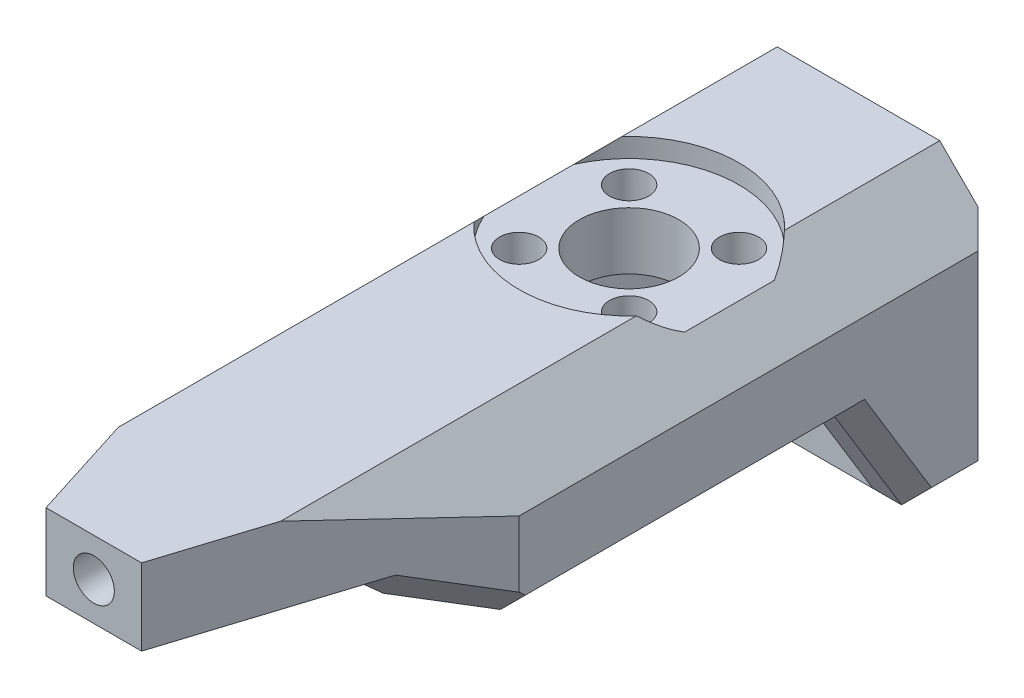
from build123d import *

# Parameters (mm, degrees)
SKETCH1_W           = 26
SKETCH1_H           = 23
SKETCH1_R           = 1.05
BOSS_EXTRUDE1_DEPTH = 8
SKETCH2_R           = 3.55
CUT_EXTRUDE1_DEPTH  = 1
BOSS_EXTRUDE2_DEPTH = 72
SKETCH4_W           = 80
SKETCH4_H           = 23
BOSS_EXTRUDE3_DEPTH = 1.5
SKETCH5_W           = 80
SKETCH5_H           = 23
BOSS_EXTRUDE4_DEPTH = 1.5
SKETCH6_W           = 29
SKETCH6_H           = 80
BOSS_EXTRUDE5_DEPTH = 2
CUT_EXTRUDE2_DEPTH  = 87.15828457
SKETCH8_W           = 30
SKETCH8_H           = 4
BOSS_EXTRUDE6_DEPTH = 29
CUT_EXTRUDE3_DEPTH  = 87.32062326
SKETCH10_W          = 15.789473684
SKETCH10_H          = 7.5
CUT_EXTRUDE4_DEPTH  = 87.874910072
CHAMFER1_SIZE2      = 7.5
CHAMFER1_SIZE       = 15
CHAMFER2_SIZE2      = 7.5
CHAMFER2_SIZE       = 15
CHAMFER3_SIZE       = 4
CHAMFER3_SIZE_2     = 10
SKETCH12_R          = 5.2
CUT_EXTRUDE5_DEPTH  = 86.060272748
SKETCH14_R          = 2.05
CUT_EXTRUDE6_DEPTH  = 5
SKETCH15_R          = 2.15
CUT_EXTRUDE8_DEPTH  = 22
SKETCH21_W          = 29
SKETCH21_H          = 2
CUT_EXTRUDE9_DEPTH  = 84.165497654
BOSS_EXTRUDE7_REACH = 84.768
SKETCH22_W          = 29
SKETCH22_H          = 2
SKETCH23_R          = 5.2
CUT_EXTRUDE10_DEPTH = 86.060272748
SKETCH24_R          = 11.5
CUT_EXTRUDE11_DEPTH = 2
CHAMFER6_SIZE       = 2


# Some blends are built 0.0001 mm under size
with BuildPart() as part:
    # Sketch1 → Boss-Extrude1 (new body)
    with BuildSketch(Plane.XY):
        Rectangle(SKETCH1_W, SKETCH1_H)
        with Locations((-6, 4)):
            Circle(SKETCH1_R, mode=Mode.SUBTRACT)
        with Locations((6, 4)):
            Circle(SKETCH1_R, mode=Mode.SUBTRACT)
        with Locations((-6, -4)):
            Circle(SKETCH1_R, mode=Mode.SUBTRACT)
        with Locations((6, -4)):
            Circle(SKETCH1_R, mode=Mode.SUBTRACT)
    extrude(amount=BOSS_EXTRUDE1_DEPTH)

    # Sketch2 → Cut-Extrude1 (cut)
    with BuildSketch(Plane.XY.offset(8)):
        with Locations((-6, 4)):
            Circle(SKETCH2_R)
        with Locations((6, 4)):
            Circle(SKETCH2_R)
        with Locations((6, -4)):
            Circle(SKETCH2_R)
        with Locations((-6, -4)):
            Circle(SKETCH2_R)
    extrude(amount=-CUT_EXTRUDE1_DEPTH, mode=Mode.SUBTRACT)

    # Sketch3 → Boss-Extrude2 (add)
    with BuildSketch(Plane.XY.offset(8)):
        Polygon((-13, 11.5), (13, 11.5), (13, 7.5), (13, -11.5), (9.5, -11.5), (9.5, 7.5), (-9.5, 7.5), (-9.5, -11.5), (-13, -11.5), (-13, 7.5), align=None)
    extrude(amount=BOSS_EXTRUDE2_DEPTH)

    # Sketch4 → Boss-Extrude3 (add)
    with BuildSketch(Plane.ZY.offset(13)):
        with Locations((40, 0)):
            Rectangle(SKETCH4_W, SKETCH4_H)
    extrude(amount=BOSS_EXTRUDE3_DEPTH)

    # Sketch5 → Boss-Extrude4 (add)
    with BuildSketch(Plane(origin=(13, 0, 0), x_dir=(0, 0, -1), z_dir=(1, 0, 0))):
        with Locations((-40, 0)):
            Rectangle(SKETCH5_W, SKETCH5_H)
    extrude(amount=BOSS_EXTRUDE4_DEPTH)

    # Sketch6 → Boss-Extrude5 (add)
    with BuildSketch(Plane(origin=(0, 11.5, 0), x_dir=(1, 0, 0), z_dir=(0, 1, 0))):
        with Locations((0, -40)):
            Rectangle(SKETCH6_W, SKETCH6_H)
    extrude(amount=BOSS_EXTRUDE5_DEPTH)

    # Sketch7 → Cut-Extrude2 (cut, through all)
    with BuildSketch(Plane(origin=(14.5, 0, 0), x_dir=(0, 0, -1), z_dir=(1, 0, 0))):
        Polygon((-8, -11.5), (-15, 0), (-52, 0), (-80, 7.5), (-80, -11.5), align=None)
    extrude(amount=-CUT_EXTRUDE2_DEPTH, mode=Mode.SUBTRACT)

    # Sketch8 → Boss-Extrude6 (add)
    with BuildSketch(Plane.ZY.offset(14.5)):
        with Locations((65, 15.5)):
            Rectangle(SKETCH8_W, SKETCH8_H)
    extrude(amount=-BOSS_EXTRUDE6_DEPTH)

    # Sketch9 → Cut-Extrude3 (cut, through all)
    with BuildSketch(Plane(origin=(0, 17.5, 0), x_dir=(1, 0, 0), z_dir=(0, 1, 0))):
        Polygon((-5, -80), (-14.5, -50), (-14.5, -80), align=None)
        Polygon((14.5, -50), (14.5, -80), (5, -80), align=None)
    extrude(amount=-CUT_EXTRUDE3_DEPTH, mode=Mode.SUBTRACT)

    # Sketch10 → Cut-Extrude4 (cut, through all)
    with BuildSketch(Plane(origin=(14.5, 0, 0), x_dir=(0, 0, -1), z_dir=(1, 0, 0))):
        with Locations((-57.894736842, 3.75)):
            Rectangle(SKETCH10_W, SKETCH10_H)
    extrude(amount=-CUT_EXTRUDE4_DEPTH, mode=Mode.SUBTRACT)

    # Chamfer1
    chamfer1_edges = [part.edges().sort_by_distance(p)[0] for p in [
        (12, 7.5, 50),
    ]]
    chamfer1_side = [part.faces().sort_by_distance(p)[0] for p in [
        (12, 7.5, 50.15),
    ]]
    chamfer(chamfer1_edges, length=CHAMFER1_SIZE - 0.0001, length2=CHAMFER1_SIZE2 - 0.0001, reference=chamfer1_side[0])  # a hair under: the kernel refuses the full size

    # Chamfer2
    chamfer2_edges = [part.edges().sort_by_distance(p)[0] for p in [
        (-12, 7.5, 50),
    ]]
    chamfer2_side = [part.faces().sort_by_distance(p)[0] for p in [
        (-12, 7.5, 50.15),
    ]]
    chamfer(chamfer2_edges, length=CHAMFER2_SIZE - 0.0001, length2=CHAMFER2_SIZE2 - 0.0001, reference=chamfer2_side[0])  # a hair under: the kernel refuses the full size

    # Chamfer3
    # the kernel refuses this chamfer: 10, 4 mm, written as the material it adds along each edge
    with BuildSketch(Plane(origin=(-14.5, 13.5, 50), x_dir=(0, 0.996016754004022, 0.08916628142572501), z_dir=(1, 0, 0))) as chamfer3_piece_1_section:
        Polygon((CHAMFER3_SIZE * 0.996016754004, -CHAMFER3_SIZE * 0.0891662814257), (-CHAMFER3_SIZE_2 * 0.0891662814257, -CHAMFER3_SIZE_2 * 0.996016754004), (0, 0), align=None)
    chamfer3_piece_1 = extrude(amount=29, mode=Mode.PRIVATE)
    chamfer3_piece_1 = split(chamfer3_piece_1, bisect_by=Plane(origin=(0, 17.5, 46.584895752), z_dir=(0, -1, 0)), keep=Keep.TOP, mode=Mode.PRIVATE)
    chamfer3_piece_1 = split(chamfer3_piece_1, bisect_by=Plane(origin=(-14.161378148, 14.736098837, 51.069332166), z_dir=(0.9533422253507436, 0, -0.3018917046944019)), keep=Keep.TOP, mode=Mode.PRIVATE)
    chamfer3_piece_1 = split(chamfer3_piece_1, bisect_by=Plane(origin=(14.161378148, 14.736098837, 51.069332166), z_dir=(-0.9533422253507436, 0, -0.30189170469440213)), keep=Keep.TOP, mode=Mode.PRIVATE)
    add(chamfer3_piece_1)

    # Sketch12 → Cut-Extrude5 (cut, through all)
    with BuildSketch(Plane(origin=(0, 13.5, 0), x_dir=(1, 0, 0), z_dir=(0, 1, 0))):
        with Locations(Location((0, -24, 0), (0, 0, 270))):
            Circle(SKETCH12_R)
    extrude(amount=-CUT_EXTRUDE5_DEPTH, mode=Mode.SUBTRACT)

    # Sketch14 → Cut-Extrude6 (cut)
    with BuildSketch(Plane(origin=(0, 13.5, 0), x_dir=(1, 0, 0), z_dir=(0, 1, 0))):
        with Locations(Location((5.75, -18.25, 0), (0, 0, 270))):
            Circle(SKETCH14_R)
        with Locations(Location((5.75, -29.75, 0), (0, 0, 270))):
            Circle(SKETCH14_R)
        with Locations(Location((-5.75, -29.75, 0), (0, 0, 270))):
            Circle(SKETCH14_R)
        with Locations(Location((-5.75, -18.25, 0), (0, 0, 270))):
            Circle(SKETCH14_R)
    extrude(amount=-CUT_EXTRUDE6_DEPTH, mode=Mode.SUBTRACT)

    # Sketch15 → Cut-Extrude8 (cut)
    with BuildSketch(Plane.XY.offset(80)):
        with Locations((0, 11.5)):
            Circle(SKETCH15_R)
    extrude(amount=-CUT_EXTRUDE8_DEPTH, mode=Mode.SUBTRACT)

    # Sketch21 → Cut-Extrude9 (cut, through all)
    with BuildSketch(Plane.XY.offset(80)):
        with Locations((0, 16.5)):
            Rectangle(SKETCH21_W, SKETCH21_H)
    extrude(amount=-CUT_EXTRUDE9_DEPTH, mode=Mode.SUBTRACT)

    # Boss-Extrude7: up to this face of the body (flat: up to its plane)
    boss_extrude7_end = Plane(part.part.faces().sort_by_distance((0, 14.5, 42.5))[0])
    # Sketch22 → Boss-Extrude7 (add, up to the picked face)
    with BuildSketch(Plane(origin=(0, 0, 0), x_dir=(-1, 0, 0), z_dir=(0, 0, -1)), mode=Mode.PRIVATE) as boss_extrude7_sk1:
        with Locations((0, 14.5)):
            Rectangle(SKETCH22_W, SKETCH22_H)
    boss_extrude7_tool1 = split(extrude(boss_extrude7_sk1.sketch, amount=-BOSS_EXTRUDE7_REACH, mode=Mode.PRIVATE), bisect_by=boss_extrude7_end, keep=Keep.BOTH, mode=Mode.PRIVATE)
    add(boss_extrude7_tool1.solids().sort_by(Axis((0, 14.5, 0), (0, 0, 1)))[0])

    # Sketch23 → Cut-Extrude10 (cut, through all)
    with BuildSketch(Plane(origin=(0, 13.5, 0), x_dir=(-1, 0, 0), z_dir=(0, -1, 0))):
        with Locations(Location((0, -24, 0), (0, 0, 270))):
            Circle(SKETCH23_R)
    extrude(amount=-CUT_EXTRUDE10_DEPTH, mode=Mode.SUBTRACT)

    # Sketch24 → Cut-Extrude11 (cut)
    with BuildSketch(Plane(origin=(0, 15.5, 0), x_dir=(1, 0, 0), z_dir=(0, 1, 0))):
        with Locations(Location((0, -24, 0), (0, 0, 270))):
            Circle(SKETCH24_R)
    extrude(amount=-CUT_EXTRUDE11_DEPTH, mode=Mode.SUBTRACT)

    # Chamfer4
    # the kernel refuses this chamfer: 6 mm, written as the material it takes off along each edge
    with BuildSketch(Plane(origin=(-14.5, 15.5, 87.032235027), x_dir=(-0.0274958766105865, -0.9996219169112968, 0), z_dir=(0, 0, -1)), Plane(origin=(14.5, 15.5, 87.032235027), x_dir=(-0.9996219169112969, 0.02749587661058649, 0), z_dir=(0, 0, -1))) as chamfer4_piece_1:
        with BuildLine():
            Line((6.172039171, 0), (-0.339282929, -6.162706761))
            Line((-0.339282929, -6.162706761), (-0.459237559, -6.159407256))
            ThreePointArc((-0.459237559, -6.159407256), (-0.204775362, -3.080386978), (-0.11995463, 0.003299505))
            Line((-0.11995463, 0.003299505), (0.003299505, 0.11995463))
            ThreePointArc((0.003299505, 0.11995463), (3.086985988, 0.035133898), (6.175338676, 0.11995463))
            Line((6.175338676, 0.11995463), (6.172039171, 0))
        make_face()
    extrude(amount=124.064470053, mode=Mode.SUBTRACT)

    # Chamfer5
    # the kernel refuses this chamfer: 2.336899136, 2 mm, written as the material it takes off along each edge
    with BuildSketch(Plane(origin=(-8.106777279, 10.094594893, 70.189124382), x_dir=(0.961659390492848, -0.1504091467073527, -0.22932140166955664), z_dir=(-0.2725155737769916, -0.43028487946482336, -0.8605754961378691))) as chamfer5_piece_1_section:
        with BuildLine():
            Line((2.067154496, 0), (-0.457557549, -2.368181214))
            Line((-0.457557549, -2.368181214), (-0.503642169, -2.360393606))
            ThreePointArc((-0.503642169, -2.360393606), (-0.246974517, -1.1810158), (-0.04608462, 0.007787608))
            Line((-0.04608462, 0.007787608), (0.001494452, 0.046714084))
            ThreePointArc((0.001494452, 0.046714084), (1.034014963, 0.013682238), (2.068648949, 0.046714084))
            Line((2.068648949, 0.046714084), (2.067154496, 0))
        make_face()
    chamfer5_piece_1 = extrude(amount=29.489973718, mode=Mode.PRIVATE)
    chamfer5_piece_1 = split(chamfer5_piece_1, bisect_by=Plane(origin=(-11.667443521, 7.5, 56.707905071), z_dir=(0, -1, 0)), keep=Keep.TOP, mode=Mode.PRIVATE)
    add(chamfer5_piece_1, mode=Mode.SUBTRACT)
    with BuildSketch(Plane(origin=(8.106777279, 10.094594893, 70.189124382), x_dir=(-0.961659390492848, -0.1504091467073528, -0.22932140166955695), z_dir=(0.27251557377699187, -0.4302848794648234, -0.860575496137869))) as chamfer5_piece_2_section:
        with BuildLine():
            Line((2.067154496, 0), (-0.457557549, 2.368181214))
            Line((-0.457557549, 2.368181214), (-0.503642169, 2.360393606))
            ThreePointArc((-0.503642169, 2.360393606), (-0.246974517, 1.1810158), (-0.04608462, -0.007787608))
            Line((-0.04608462, -0.007787608), (0.001494452, -0.046714084))
            ThreePointArc((0.001494452, -0.046714084), (1.034014963, -0.013682238), (2.068648949, -0.046714084))
            Line((2.068648949, -0.046714084), (2.067154496, 0))
        make_face()
    chamfer5_piece_2 = extrude(amount=29.489973718, mode=Mode.PRIVATE)
    chamfer5_piece_2 = split(chamfer5_piece_2, bisect_by=Plane(origin=(11.667443521, 7.5, 56.707905071), z_dir=(0, -1, 0)), keep=Keep.TOP, mode=Mode.PRIVATE)
    add(chamfer5_piece_2, mode=Mode.SUBTRACT)
    with BuildSketch(Plane(origin=(14.5, 0, 9.856634024), x_dir=(0.02749587661058647, 0.9996219169112968, 0), z_dir=(0, 0, 1))) as chamfer5_piece_3_section:
        with BuildLine():
            Line((2.05734639, 0), (-0.11309431, 2.054235587))
            Line((-0.11309431, 2.054235587), (-0.153079186, 2.053135752))
            ThreePointArc((-0.153079186, 2.053135752), (-0.068258454, 1.026795659), (-0.039984877, -0.001099835))
            Line((-0.039984877, -0.001099835), (0.001099835, -0.039984877))
            ThreePointArc((0.001099835, -0.039984877), (1.028995329, -0.011711299), (2.058446225, -0.039984877))
            Line((2.058446225, -0.039984877), (2.05734639, 0))
        make_face()
    chamfer5_piece_3 = extrude(amount=45.286731952, mode=Mode.PRIVATE)
    chamfer5_piece_3 = split(chamfer5_piece_3, bisect_by=Plane(origin=(13.83833288, 9.481660415, 20.77144547), z_dir=(0, -0.5199469468957453, 0.8541985556144386)), keep=Keep.TOP, mode=Mode.PRIVATE)
    add(chamfer5_piece_3, mode=Mode.SUBTRACT)
    with BuildSketch(Plane(origin=(-14.5, 4.393455788, 17.674277436), x_dir=(-0.027495876610586452, 0.519750363748101, -0.8538755975861659), z_dir=(0, -0.8541985556144386, -0.5199469468957453))) as chamfer5_piece_4_section:
        with BuildLine():
            Line((2.05734639, 0), (-0.11309431, 2.054235587))
            Line((-0.11309431, 2.054235587), (-0.153079186, 2.053135752))
            ThreePointArc((-0.153079186, 2.053135752), (-0.068258454, 1.026795659), (-0.039984877, -0.001099835))
            Line((-0.039984877, -0.001099835), (0.001099835, -0.039984877))
            ThreePointArc((0.001099835, -0.039984877), (1.028995329, -0.011711299), (2.058446225, -0.039984877))
            Line((2.058446225, -0.039984877), (2.05734639, 0))
        make_face()
    chamfer5_piece_4 = extrude(amount=23.74964397, mode=Mode.PRIVATE)
    chamfer5_piece_4 = split(chamfer5_piece_4, bisect_by=Plane(origin=(-13.835872305, 0, 9.503665371), z_dir=(0, -1, 0)), keep=Keep.TOP, mode=Mode.PRIVATE)
    add(chamfer5_piece_4, mode=Mode.SUBTRACT)
    with BuildSketch(Plane(origin=(14.5, -15.893455788, 5.325722564), x_dir=(0.027495876610586504, 0.5197503637481011, -0.8538755975861659), z_dir=(0, 0.8541985556144386, 0.5199469468957453))) as chamfer5_piece_5_section:
        with BuildLine():
            Line((2.05734639, 0), (-0.11309431, 2.054235587))
            Line((-0.11309431, 2.054235587), (-0.153079186, 2.053135752))
            ThreePointArc((-0.153079186, 2.053135752), (-0.068258454, 1.026795659), (-0.039984877, -0.001099835))
            Line((-0.039984877, -0.001099835), (0.001099835, -0.039984877))
            ThreePointArc((0.001099835, -0.039984877), (1.028995329, -0.011711299), (2.058446225, -0.039984877))
            Line((2.058446225, -0.039984877), (2.05734639, 0))
        make_face()
    chamfer5_piece_5 = extrude(amount=23.74964397, mode=Mode.PRIVATE)
    chamfer5_piece_5 = split(chamfer5_piece_5, bisect_by=Plane(origin=(13.835872305, 0, 9.503665371), z_dir=(0, -1, 0)), keep=Keep.TOP, mode=Mode.PRIVATE)
    add(chamfer5_piece_5, mode=Mode.SUBTRACT)
    with BuildSketch(Plane(origin=(14.5, -11.5, 13.143365976), x_dir=(0.027495876610586438, 0.9996219169112968, 0), z_dir=(0, 0, -1)), Plane(origin=(-14.5, -11.5, -5.143365976), x_dir=(-0.027495876610586487, 0.9996219169112968, 0), z_dir=(0, 0, 1))) as chamfer5_piece_6:
        with BuildLine():
            Line((2.05734639, 0), (-0.11309431, -2.054235587))
            Line((-0.11309431, -2.054235587), (-0.153079186, -2.053135752))
            ThreePointArc((-0.153079186, -2.053135752), (-0.068258454, -1.026795659), (-0.039984877, 0.001099835))
            Line((-0.039984877, 0.001099835), (0.001099835, 0.039984877))
            ThreePointArc((0.001099835, 0.039984877), (1.028995329, 0.011711299), (2.058446225, 0.039984877))
            Line((2.058446225, 0.039984877), (2.05734639, 0))
        make_face()
    extrude(amount=18.286731952, mode=Mode.SUBTRACT)
    with BuildSketch(Plane(origin=(-14.5, 0, 55.143365976), x_dir=(-0.027495876610586494, 0.9996219169112968, 0), z_dir=(0, 0, -1))) as chamfer5_piece_7_section:
        with BuildLine():
            Line((2.05734639, 0), (-0.11309431, 2.054235587))
            Line((-0.11309431, 2.054235587), (-0.153079186, 2.053135752))
            ThreePointArc((-0.153079186, 2.053135752), (-0.068258454, 1.026795659), (-0.039984877, -0.001099835))
            Line((-0.039984877, -0.001099835), (0.001099835, -0.039984877))
            ThreePointArc((0.001099835, -0.039984877), (1.028995329, -0.011711299), (2.058446225, -0.039984877))
            Line((2.058446225, -0.039984877), (2.05734639, 0))
        make_face()
    chamfer5_piece_7 = extrude(amount=45.286731952, mode=Mode.PRIVATE)
    chamfer5_piece_7 = split(chamfer5_piece_7, bisect_by=Plane(origin=(-13.83833288, 9.481660415, 20.77144547), z_dir=(0, -0.5199469468957453, 0.8541985556144386)), keep=Keep.TOP, mode=Mode.PRIVATE)
    add(chamfer5_piece_7, mode=Mode.SUBTRACT)
    with BuildSketch(Plane(origin=(14.5, 0, 9.856634024), x_dir=(0.02749587661058647, 0.9996219169112968, 0), z_dir=(0, 0, 1))) as chamfer5_piece_8a_section:
        with BuildLine():
            Line((2.05734639, 0), (-0.11309431, 2.054235587))
            Line((-0.11309431, 2.054235587), (-0.153079186, 2.053135752))
            ThreePointArc((-0.153079186, 2.053135752), (-0.068258454, 1.026795659), (-0.039984877, -0.001099835))
            Line((-0.039984877, -0.001099835), (0.001099835, -0.039984877))
            ThreePointArc((0.001099835, -0.039984877), (1.028995329, -0.011711299), (2.058446225, -0.039984877))
            Line((2.058446225, -0.039984877), (2.05734639, 0))
        make_face()
    chamfer5_piece_8a = extrude(amount=45.286731952, mode=Mode.PRIVATE)
    chamfer5_piece_8a = split(chamfer5_piece_8a, bisect_by=Plane(origin=(13.855319863, -0.547637516, 14.666655425), z_dir=(0, 0.5199469468957453, -0.8541985556144386)), keep=Keep.TOP, mode=Mode.PRIVATE)
    with BuildSketch(Plane(origin=(14.5, -15.893455788, 5.325722564), x_dir=(0.027495876610586504, 0.5197503637481011, -0.8538755975861659), z_dir=(0, 0.8541985556144386, 0.5199469468957453))) as chamfer5_piece_8b_section:
        with BuildLine():
            Line((2.05734639, 0), (-0.11309431, 2.054235587))
            Line((-0.11309431, 2.054235587), (-0.153079186, 2.053135752))
            ThreePointArc((-0.153079186, 2.053135752), (-0.068258454, 1.026795659), (-0.039984877, -0.001099835))
            Line((-0.039984877, -0.001099835), (0.001099835, -0.039984877))
            ThreePointArc((0.001099835, -0.039984877), (1.028995329, -0.011711299), (2.058446225, -0.039984877))
            Line((2.058446225, -0.039984877), (2.05734639, 0))
        make_face()
    chamfer5_piece_8b = extrude(amount=23.74964397, mode=Mode.PRIVATE)
    chamfer5_piece_8b = split(chamfer5_piece_8b, bisect_by=Plane(origin=(13.855319863, 0, 15.64111267), z_dir=(0, 1, 0)), keep=Keep.TOP, mode=Mode.PRIVATE)
    chamfer5_piece_8 = chamfer5_piece_8a & chamfer5_piece_8b
    add(chamfer5_piece_8, mode=Mode.SUBTRACT)
    with BuildSketch(Plane(origin=(-14.5, 0, 55.143365976), x_dir=(-0.027495876610586494, 0.9996219169112968, 0), z_dir=(0, 0, -1))) as chamfer5_piece_9a_section:
        with BuildLine():
            Line((2.05734639, 0), (-0.11309431, 2.054235587))
            Line((-0.11309431, 2.054235587), (-0.153079186, 2.053135752))
            ThreePointArc((-0.153079186, 2.053135752), (-0.068258454, 1.026795659), (-0.039984877, -0.001099835))
            Line((-0.039984877, -0.001099835), (0.001099835, -0.039984877))
            ThreePointArc((0.001099835, -0.039984877), (1.028995329, -0.011711299), (2.058446225, -0.039984877))
            Line((2.058446225, -0.039984877), (2.05734639, 0))
        make_face()
    chamfer5_piece_9a = extrude(amount=45.286731952, mode=Mode.PRIVATE)
    chamfer5_piece_9a = split(chamfer5_piece_9a, bisect_by=Plane(origin=(-13.855319863, -0.547637516, 14.666655425), z_dir=(0, 0.5199469468957453, -0.8541985556144386)), keep=Keep.TOP, mode=Mode.PRIVATE)
    with BuildSketch(Plane(origin=(-14.5, 4.393455788, 17.674277436), x_dir=(-0.027495876610586452, 0.519750363748101, -0.8538755975861659), z_dir=(0, -0.8541985556144386, -0.5199469468957453))) as chamfer5_piece_9b_section:
        with BuildLine():
            Line((2.05734639, 0), (-0.11309431, 2.054235587))
            Line((-0.11309431, 2.054235587), (-0.153079186, 2.053135752))
            ThreePointArc((-0.153079186, 2.053135752), (-0.068258454, 1.026795659), (-0.039984877, -0.001099835))
            Line((-0.039984877, -0.001099835), (0.001099835, -0.039984877))
            ThreePointArc((0.001099835, -0.039984877), (1.028995329, -0.011711299), (2.058446225, -0.039984877))
            Line((2.058446225, -0.039984877), (2.05734639, 0))
        make_face()
    chamfer5_piece_9b = extrude(amount=23.74964397, mode=Mode.PRIVATE)
    chamfer5_piece_9b = split(chamfer5_piece_9b, bisect_by=Plane(origin=(-13.855319863, 0, 15.64111267), z_dir=(0, 1, 0)), keep=Keep.TOP, mode=Mode.PRIVATE)
    chamfer5_piece_9 = chamfer5_piece_9a & chamfer5_piece_9b
    add(chamfer5_piece_9, mode=Mode.SUBTRACT)

    # Chamfer6
    chamfer6_edges = [part.edges().sort_by_distance(p)[0] for p in [
        (14.5, 0, 0),
        (-14.5, 0, 0),
    ]]
    chamfer(chamfer6_edges, length=CHAMFER6_SIZE)


solid = part.part
